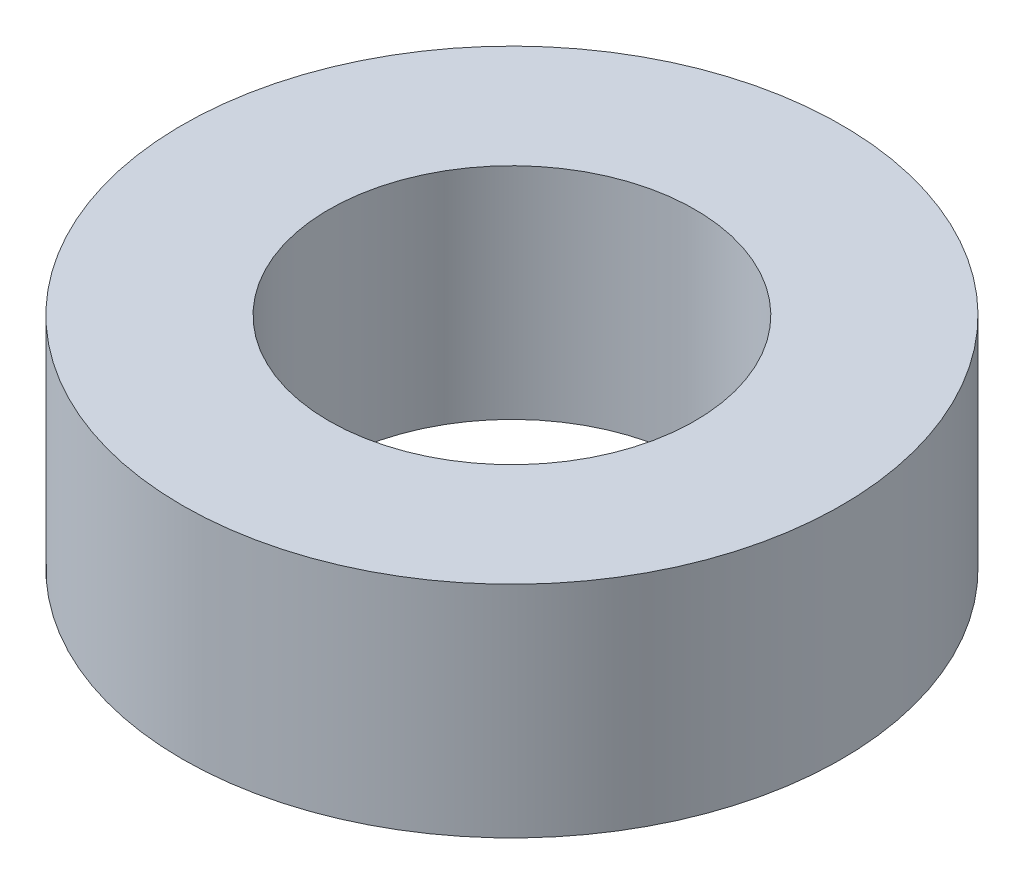
from build123d import *

# Parameters (mm, degrees)
SKETCH1_R           = 45
BOSS_EXTRUDE1_DEPTH = 30
SKETCH2_R           = 25
CUT_EXTRUDE1_DEPTH  = 71.356236397


with BuildPart() as part:
    # Sketch1 → Boss-Extrude1 (new body)
    with BuildSketch(Plane(origin=(0, 0, 0), x_dir=(1, 0, 0), z_dir=(0, 1, 0))):
        Circle(SKETCH1_R)
    extrude(amount=BOSS_EXTRUDE1_DEPTH)

    # Sketch2 → Cut-Extrude1 (cut, through all)
    with BuildSketch(Plane(origin=(0, 0, 0), x_dir=(1, 0, 0), z_dir=(0, 1, 0))):
        Circle(SKETCH2_R)
    extrude(amount=CUT_EXTRUDE1_DEPTH, mode=Mode.SUBTRACT)


solid = part.part
